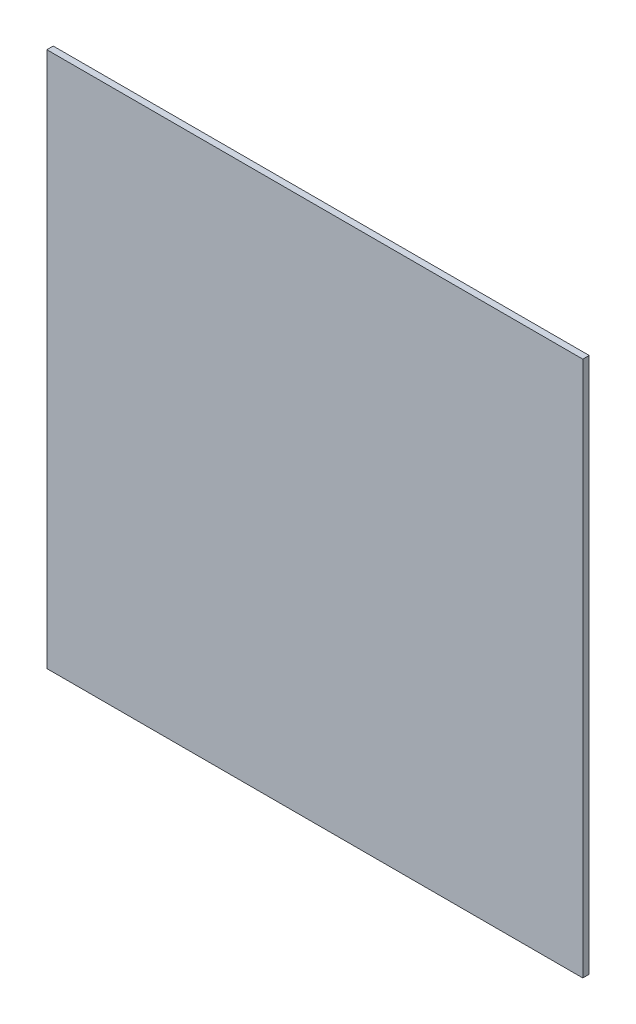
from build123d import *

# Parameters (mm, degrees)
SKETCH2_W           = 335.4
SKETCH2_H           = 335.4
BOSS_EXTRUDE2_DEPTH = 4


with BuildPart() as part:
    # Sketch2 → Boss-Extrude2 (new body)
    with BuildSketch(Plane.XY):
        Rectangle(SKETCH2_W, SKETCH2_H)
    extrude(amount=BOSS_EXTRUDE2_DEPTH)


solid = part.part
